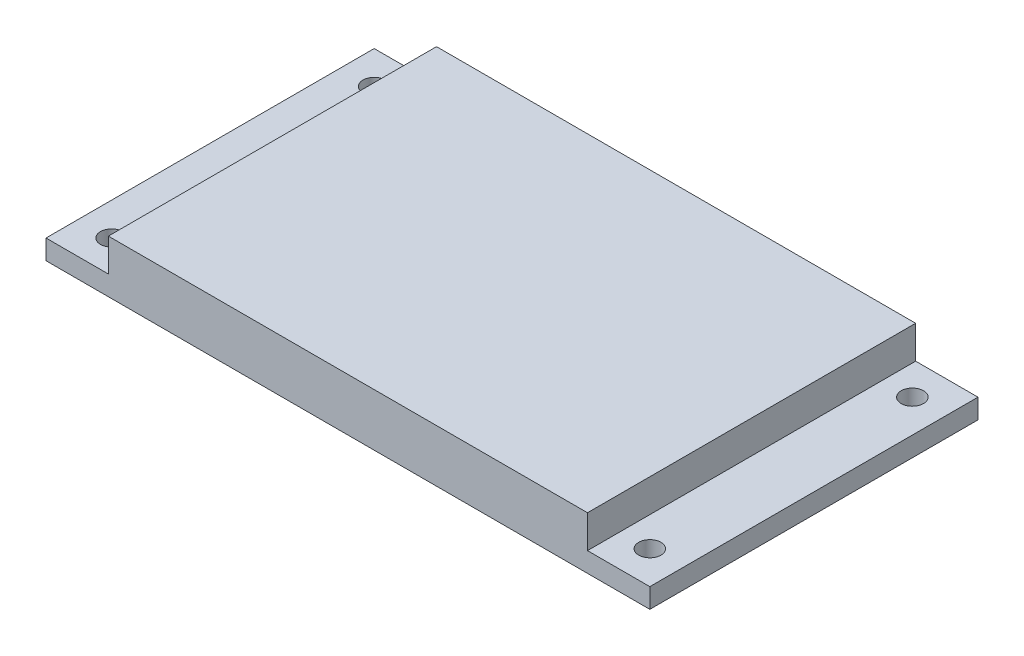
from build123d import *

# Parameters (mm, degrees)
SKETCH1_W                = 73
SKETCH1_H                = 50
BOSS_EXTRUDE1_DEPTH      = 5
SKETCH2_W                = 92
SKETCH2_H                = 50
BOSS_EXTRUDE2_DEPTH      = 3
M3_CLEARANCE_HOLE1_D     = 3.4
M3_CLEARANCE_HOLE1_DEPTH = 10
M3_CLEARANCE_HOLE1_TIP   = 1.021463052


with BuildPart() as part:
    # Sketch1 → Boss-Extrude1 (new body)
    with BuildSketch(Plane(origin=(0, 0, 0), x_dir=(1, 0, 0), z_dir=(0, 1, 0))):
        Rectangle(SKETCH1_W, SKETCH1_H)
    extrude(amount=BOSS_EXTRUDE1_DEPTH)

    # Sketch2 → Boss-Extrude2 (add)
    with BuildSketch(Plane.XZ):
        Rectangle(SKETCH2_W, SKETCH2_H)
    extrude(amount=BOSS_EXTRUDE2_DEPTH)

    # M3 Clearance Hole1
    with Locations(Plane(origin=(0, 0, 0), x_dir=(1, 0, 0), z_dir=(0, 1, 0))):
        with Locations((-41, 20), (-41, -20), (41, 20), (41, -20)):
            Hole(M3_CLEARANCE_HOLE1_D / 2, depth=M3_CLEARANCE_HOLE1_DEPTH)
            with Locations((0, 0, -(M3_CLEARANCE_HOLE1_DEPTH + M3_CLEARANCE_HOLE1_TIP / 2))):  # 118° drill point
                Cone(0, M3_CLEARANCE_HOLE1_D / 2, M3_CLEARANCE_HOLE1_TIP, mode=Mode.SUBTRACT)


solid = part.part
